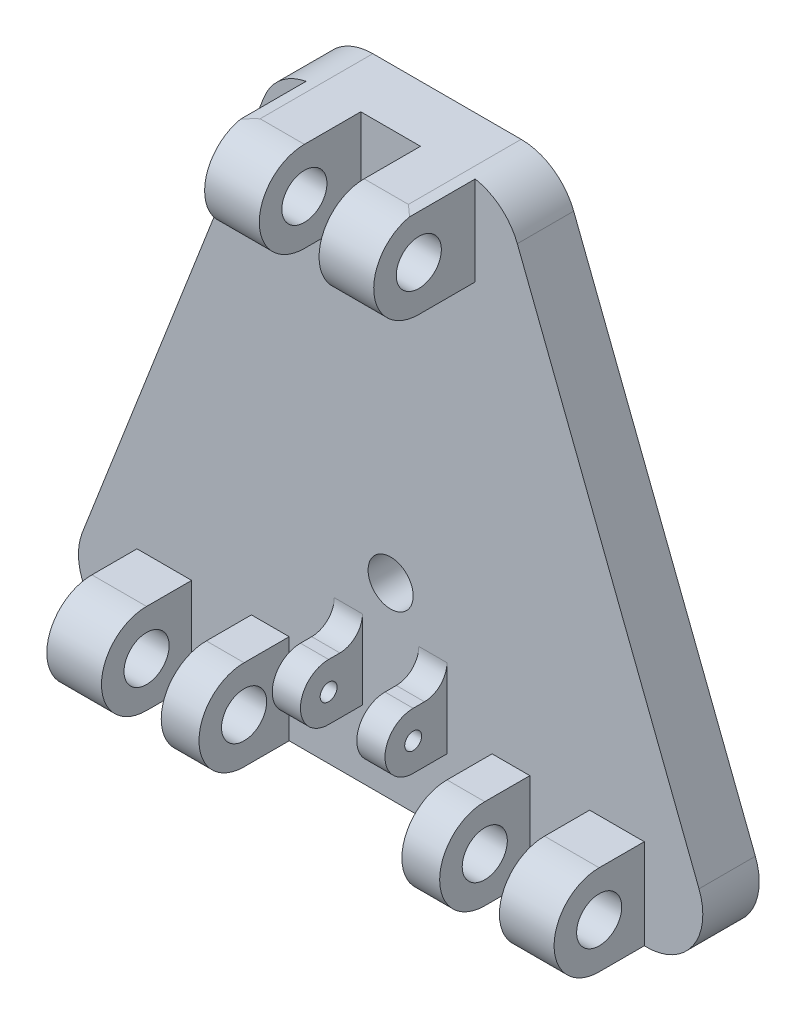
from build123d import *

# Parameters (mm, degrees)
BOSS_EXTRUDE1_DEPTH = 2.5
SKETCH2_R           = 2
BOSS_EXTRUDE2_DEPTH = 22.5
CUT_EXTRUDE1_REACH  = 62.519
SKETCH3_W           = 18
SKETCH3_H           = 16
SKETCH3_W_2         = 5.3
SKETCH7_R           = 2
BOSS_EXTRUDE4_DEPTH = 7.5
SKETCH8_W           = 5.3
SKETCH8_H           = 18
CUT_EXTRUDE4_DEPTH  = 8
SKETCH4_R           = 0.75
BOSS_EXTRUDE3_DEPTH = 5
SKETCH5_W           = 5
SKETCH5_H           = 11
CUT_EXTRUDE2_DEPTH  = 52.696228102
FILLET2_R           = 2
SKETCH6_R           = 2
CUT_EXTRUDE3_DEPTH  = 43.431010181
FILLET4_R           = 5


with BuildPart() as part:
    # Sketch1 → Boss-Extrude1 (new, symmetric)
    with BuildSketch(Plane.XY):
        Polygon((-30, -28.625), (30, -28.625), (10, 22.875), (-10, 22.875), align=None)
    extrude(amount=BOSS_EXTRUDE1_DEPTH, both=True)

    # Sketch2 → Boss-Extrude2 (add, symmetric)
    with BuildSketch(Plane(origin=(0, 0, 0), x_dir=(0, 0, -1), z_dir=(1, 0, 0))):
        with BuildLine():
            Line((-2.5, -28.625), (-6.5, -28.625))
            ThreePointArc((-6.5, -28.625), (-10.5, -24.625), (-6.5, -20.625))
            Line((-6.5, -20.625), (-2.5, -20.625))
            Line((-2.5, -20.625), (-2.5, -28.625))
        make_face()
        with Locations(Location((-6.5, -24.625, 0), (0, 0, 180))):
            Circle(SKETCH2_R, mode=Mode.SUBTRACT)
    extrude(amount=BOSS_EXTRUDE2_DEPTH, both=True)

    # Sketch3 → Cut-Extrude1 (cut, up to next)
    with BuildSketch(Plane.XZ.offset(28.625), mode=Mode.PRIVATE) as cut_extrude1_sk1:
        with Locations((0, 10.5)):
            Rectangle(SKETCH3_W, SKETCH3_H)
    cut_extrude1_tool1 = extrude(cut_extrude1_sk1.sketch, amount=-CUT_EXTRUDE1_REACH, mode=Mode.PRIVATE) & part.part
    # Sketch3 → Cut-Extrude1 (cut, up to next)
    with BuildSketch(Plane.XZ.offset(28.625), mode=Mode.PRIVATE) as cut_extrude1_sk2:
        with Locations((-15, 10.5)):
            Rectangle(SKETCH3_W_2, SKETCH3_H)
    cut_extrude1_tool2 = extrude(cut_extrude1_sk2.sketch, amount=-CUT_EXTRUDE1_REACH, mode=Mode.PRIVATE) & part.part
    cut_extrude1_1 = cut_extrude1_tool1.solids().sort_by_distance((0, -28.625, 10.5))[0]
    add(cut_extrude1_1, mode=Mode.SUBTRACT)
    cut_extrude1_2 = cut_extrude1_tool2.solids().sort_by_distance((-15, -28.625, 10.5))[0]
    add(cut_extrude1_2, mode=Mode.SUBTRACT)
    cut_extrude1 = cut_extrude1_1 + cut_extrude1_2  # Cut-Extrude1 as one shape, for the pattern or mirror that repeats it

    # Mirror2: Cut-Extrude1 across plane
    add(cut_extrude1.mirror(Plane(origin=(0, 0, 0), x_dir=(0, 0, 1), z_dir=(1, 0, 0))), mode=Mode.SUBTRACT)

    # Sketch7 → Boss-Extrude4 (add, symmetric)
    with BuildSketch(Plane(origin=(0, 0, 0), x_dir=(0, 0, -1), z_dir=(1, 0, 0))):
        with BuildLine():
            Line((-2.5, 14.875), (-7.5, 14.875))
            ThreePointArc((-7.5, 14.875), (-11.5, 18.875), (-7.5, 22.875))
            Line((-7.5, 22.875), (-2.5, 22.875))
            Line((-2.5, 22.875), (-2.5, 14.875))
        make_face()
        with Locations((-7.5, 18.875)):
            Circle(SKETCH7_R, mode=Mode.SUBTRACT)
    extrude(amount=BOSS_EXTRUDE4_DEPTH, both=True)

    # Sketch8 → Cut-Extrude4 (cut)
    with BuildSketch(Plane(origin=(0, 22.875, 0), x_dir=(1, 0, 0), z_dir=(0, 1, 0))):
        with Locations((0, -11.5)):
            Rectangle(SKETCH8_W, SKETCH8_H)
    extrude(amount=-CUT_EXTRUDE4_DEPTH, mode=Mode.SUBTRACT)

    # Sketch4 → Boss-Extrude3 (add, symmetric)
    with BuildSketch(Plane(origin=(0, 0, 0), x_dir=(0, 0, -1), z_dir=(1, 0, 0))):
        with BuildLine():
            Line((-2.5, -22.625), (-5.5, -22.625))
            ThreePointArc((-5.5, -22.625), (-8, -20.125), (-5.5, -17.625))
            Line((-5.5, -17.625), (-2.5, -17.625))
            Line((-2.5, -17.625), (-2.5, -22.625))
        make_face()
        with Locations((-5.5, -20.125)):
            Circle(SKETCH4_R, mode=Mode.SUBTRACT)
    extrude(amount=BOSS_EXTRUDE3_DEPTH, both=True)

    # Sketch5 → Cut-Extrude2 (cut, through all)
    with BuildSketch(Plane(origin=(0, -17.625, 0), x_dir=(1, 0, 0), z_dir=(0, 1, 0))):
        with Locations((0, -8)):
            Rectangle(SKETCH5_W, SKETCH5_H)
    extrude(amount=-CUT_EXTRUDE2_DEPTH, mode=Mode.SUBTRACT)

    # Fillet2
    fillet2_edges = [part.edges().sort_by_distance(p)[0] for p in [
        (3.75, -17.625, 2.5),
        (-3.75, -17.625, 2.5),
    ]]
    fillet(fillet2_edges, radius=FILLET2_R)

    # Sketch6 → Cut-Extrude3 (cut, through all)
    with BuildSketch(Plane.XY.offset(2.5)):
        with Locations((0, -12)):
            Circle(SKETCH6_R)
    extrude(amount=-CUT_EXTRUDE3_DEPTH, mode=Mode.SUBTRACT)

    # Fillet4
    # the kernel refuses this fillet: 5 mm, written as the material it takes off along each edge
    with BuildSketch(Plane(origin=(30, -28.625, -20.763876668), x_dir=(-1, 0, 0), z_dir=(0, 0, 1)), Plane(origin=(-30, -28.625, 20.763876668), x_dir=(1, 0, 0), z_dir=(0, 0, -1))) as fillet4_piece_1:
        with BuildLine():
            CenterArc((FILLET4_R * 1.46111013346, -FILLET4_R), FILLET4_R, 90, 111.223656503)
            Line((FILLET4_R * 0.52893572066, -FILLET4_R * 1.3620094807), (0, 0))
            Line((0, 0), (FILLET4_R * 1.46111013346, 0))
        make_face()
    extrude(amount=41.527753337, mode=Mode.SUBTRACT)
    with BuildSketch(Plane(origin=(10, 22.875, -11.055138804), x_dir=(0.3620094806999332, -0.9321744128023278, 0), z_dir=(0, 0, 1))) as fillet4_piece_2:
        with BuildLine():
            CenterArc((FILLET4_R * 0.684411104336, -FILLET4_R), FILLET4_R, 90, 68.776343497)
            Line((-FILLET4_R * 0.247763308466, -FILLET4_R * 0.6379905193), (0, 0))
            Line((0, 0), (FILLET4_R * 0.684411104336, 0))
        make_face()
    extrude(amount=22.110277608, mode=Mode.SUBTRACT)
    with BuildSketch(Plane(origin=(-10, 22.875, 11.055138804), x_dir=(1, 0, 0), z_dir=(0, 0, -1))) as fillet4_piece_3:
        with BuildLine():
            CenterArc((FILLET4_R * 0.684411104336, FILLET4_R), FILLET4_R, 201.223656503, 68.776343497)
            Line((-FILLET4_R * 0.247763308466, FILLET4_R * 0.6379905193), (0, 0))
            Line((0, 0), (FILLET4_R * 0.684411104336, 0))
        make_face()
    extrude(amount=22.110277608, mode=Mode.SUBTRACT)


solid = part.part
